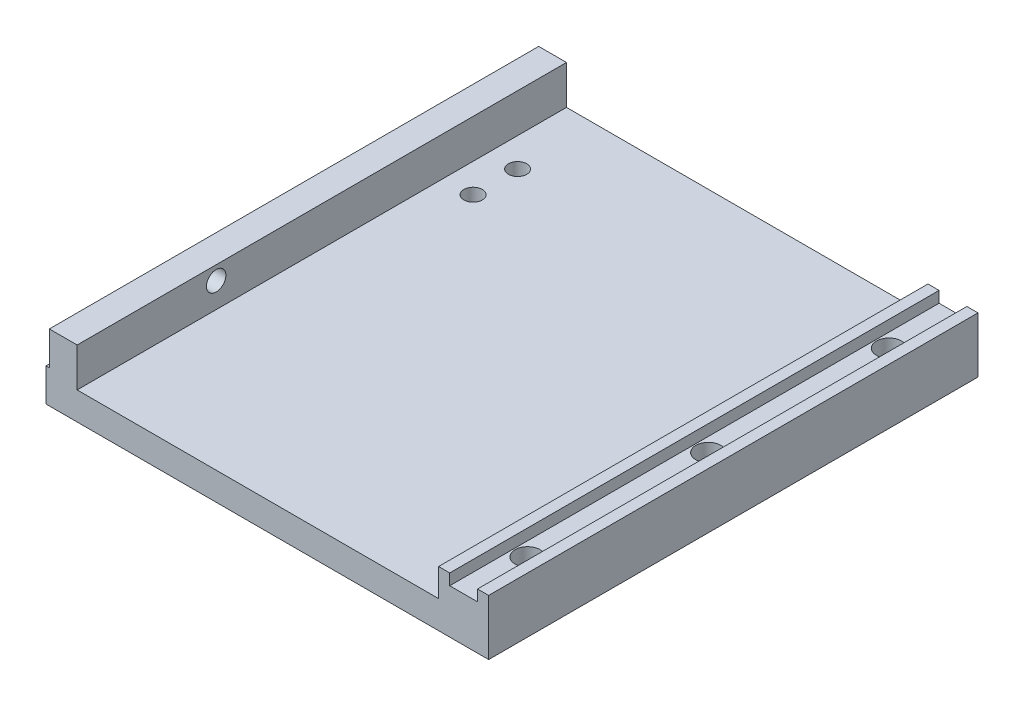
from build123d import *

# Parameters (mm, degrees)
EXTRUDE_1_DEPTH              = 88
HOLE_WIZARD_M4_1_D           = 4.5
HOLE_WIZARD_M4_1_CBORE_D     = 8
HOLE_WIZARD_M4_1_CBORE_DEPTH = 4.4
HOLE_WIZARD_M4_1_2_D         = 3.3
HOLE_WIZARD_M3_1_D           = 2.5
HOLE_WIZARD_M3_1_DEPTH       = 9.5
HOLE_WIZARD_M3_1_TIP         = 0.751075774
SKETCH_8_R                   = 1.75
CUT_EXTRUDE_1_DEPTH          = 5
SKETCH_9_W                   = 0.6
SKETCH_9_H                   = 88
EXTRUDE_2_DEPTH              = 0.05


with BuildPart() as part:
    # 草图1 → 凸台-拉伸1 (new body)
    with BuildSketch(Plane.XY):
        Polygon((-9, 10), (-9, 5), (-74, 5), (-74, 12), (-79, 12), (-79, 5.9), (-79.6, 5.9), (-79.6, 0), (0, 0), (0, 10), (-2, 10), (-2, 8), (-7, 8), (-7, 10), align=None)
    extrude(amount=EXTRUDE_1_DEPTH)

    # Hole Wizard M4 _1 (through all)
    with Locations(Plane(origin=(0, 0, 0), x_dir=(-1, 0, 0), z_dir=(0, -1, 0))):
        with Locations((4.5, -11.5), (4.5, -44), (4.5, -76.5)):
            CounterBoreHole(HOLE_WIZARD_M4_1_D / 2, HOLE_WIZARD_M4_1_CBORE_D / 2, HOLE_WIZARD_M4_1_CBORE_DEPTH)

    # Hole Wizard M4 _1 2 (through all)
    with Locations(Plane(origin=(0, 0, 0), x_dir=(-1, 0, 0), z_dir=(0, -1, 0))):
        with Locations((68.8, -14), (68.8, -22)):
            Hole(HOLE_WIZARD_M4_1_2_D / 2)

    # M3 螺纹孔1
    with Locations(Plane.ZY.offset(79.6)):
        with Locations((11.5, 3), (44, 3), (76.5, 3)):
            Hole(HOLE_WIZARD_M3_1_D / 2, depth=HOLE_WIZARD_M3_1_DEPTH)
            with Locations((0, 0, -(HOLE_WIZARD_M3_1_DEPTH + HOLE_WIZARD_M3_1_TIP / 2))):  # 118° drill point
                Cone(0, HOLE_WIZARD_M3_1_D / 2, HOLE_WIZARD_M3_1_TIP, mode=Mode.SUBTRACT)

    # 草图8 → 切除-拉伸1 (cut)
    with BuildSketch(Plane.ZY.offset(79)):
        with Locations((63, 9.5)):
            Circle(SKETCH_8_R)
    extrude(amount=-CUT_EXTRUDE_1_DEPTH, mode=Mode.SUBTRACT)

    # 草图9 → 凸台-拉伸2 (add)
    with BuildSketch(Plane(origin=(0, 5.9, 0), x_dir=(1, 0, 0), z_dir=(0, 1, 0))):
        with Locations((-79.3, -44)):
            Rectangle(SKETCH_9_W, SKETCH_9_H)
    extrude(amount=EXTRUDE_2_DEPTH)


solid = part.part
